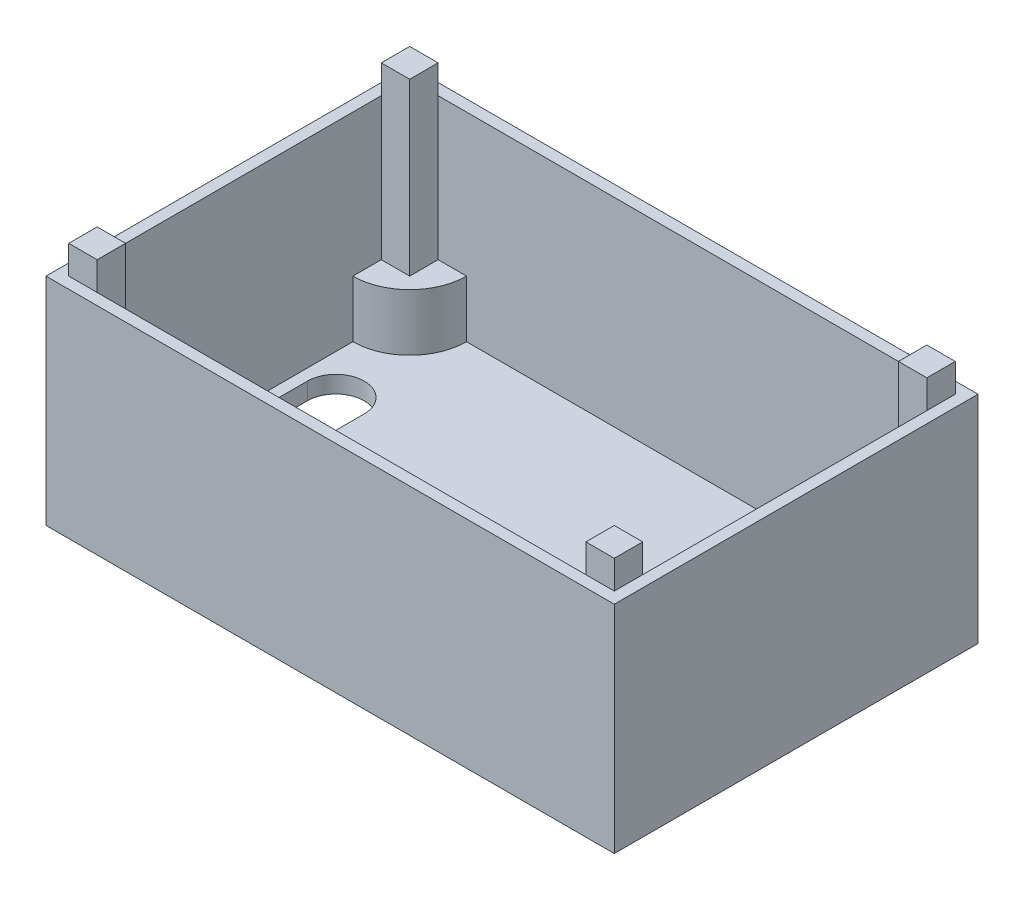
from build123d import *

# Parameters (mm, degrees)
SKETCH1_W                = 100
SKETCH1_H                = 64
BOSS_EXTRUDE1_DEPTH      = 3
SKETCH2_W                = 100
SKETCH2_H                = 64
SKETCH2_W_2              = 96
SKETCH2_H_2              = 60
BOSS_EXTRUDE2_DEPTH      = 35
BOSS_EXTRUDE9_DEPTH      = 5
BOSS_EXTRUDE9_DEPTH_BACK = 37
SKETCH12_W               = 5
SKETCH12_H               = 5
CUT_EXTRUDE6_DEPTH       = 72.582120673
BOSS_EXTRUDE11_DEPTH     = 10
SKETCH19_W               = 5
SKETCH19_H               = 5
CUT_EXTRUDE7_DEPTH       = 7
FILLET2_R                = 10


with BuildPart() as part:
    # Sketch1 → Boss-Extrude1 (new body)
    with BuildSketch(Plane(origin=(0, 0, 0), x_dir=(1, 0, 0), z_dir=(0, 1, 0))):
        Rectangle(SKETCH1_W, SKETCH1_H)
    extrude(amount=BOSS_EXTRUDE1_DEPTH)

    # Sketch2 → Boss-Extrude2 (add)
    with BuildSketch(Plane(origin=(0, 3, 0), x_dir=(1, 0, 0), z_dir=(0, 1, 0))):
        Rectangle(SKETCH2_W, SKETCH2_H)
        Rectangle(SKETCH2_W_2, SKETCH2_H_2, mode=Mode.SUBTRACT)
    extrude(amount=BOSS_EXTRUDE2_DEPTH)

    # Sketch12 → Boss-Extrude9 (add, two sides: drawn at the far end of the back side and taken through both)
    with BuildSketch(Plane(origin=(0, 38, 0), x_dir=(1, 0, 0), z_dir=(0, 1, 0)).offset(-BOSS_EXTRUDE9_DEPTH_BACK)):
        with Locations((-45.5, 27.5)):
            Rectangle(SKETCH12_W, SKETCH12_H)
        with Locations((45.5, 27.5)):
            Rectangle(SKETCH12_W, SKETCH12_H)
        with Locations((45.5, -27.5)):
            Rectangle(SKETCH12_W, SKETCH12_H)
        with Locations((-45.5, -27.5)):
            Rectangle(SKETCH12_W, SKETCH12_H)
    extrude(amount=BOSS_EXTRUDE9_DEPTH + BOSS_EXTRUDE9_DEPTH_BACK)

    # Sketch14 → Cut-Extrude6 (cut, through all)
    with BuildSketch(Plane(origin=(0, 3, 0), x_dir=(1, 0, 0), z_dir=(0, 1, 0))):
        with BuildLine():
            Line((-46, -10), (-46, 10))
            ThreePointArc((-46, 10), (-41, 15), (-36, 10))
            Line((-36, 10), (-36, -10))
            ThreePointArc((-36, -10), (-41, -15), (-46, -10))
        make_face()
    extrude(amount=-CUT_EXTRUDE6_DEPTH, mode=Mode.SUBTRACT)

    # Sketch17 → Boss-Extrude11 (add)
    with BuildSketch(Plane(origin=(0, 3, 0), x_dir=(1, 0, 0), z_dir=(0, 1, 0))):
        Polygon((-38, 30), (-43, 30), (-43, 25), (-48, 25), (-48, 20), (-38, 20), align=None)
        Polygon((43, 30), (38, 30), (38, 20), (48, 20), (48, 25), (43, 25), align=None)
        Polygon((48, -25), (48, -20), (38, -20), (38, -30), (43, -30), (43, -25), align=None)
        Polygon((-38, -20), (-48, -20), (-48, -25), (-43, -25), (-43, -30), (-38, -30), align=None)
    extrude(amount=BOSS_EXTRUDE11_DEPTH)

    # Sketch19 → Cut-Extrude7 (cut)
    with BuildSketch(Plane.XZ):
        with Locations((-45.5, 27.5)):
            Rectangle(SKETCH19_W, SKETCH19_H)
        with Locations((45.5, 27.5)):
            Rectangle(SKETCH19_W, SKETCH19_H)
        with Locations((45.5, -27.5)):
            Rectangle(SKETCH19_W, SKETCH19_H)
        with Locations((-45.5, -27.5)):
            Rectangle(SKETCH19_W, SKETCH19_H)
    extrude(amount=-CUT_EXTRUDE7_DEPTH, mode=Mode.SUBTRACT)

    # Fillet2
    fillet2_edges = [part.edges().sort_by_distance(p)[0] for p in [
        (-38, 8, 20),
        (38, 8, -20),
        (38, 8, 20),
        (-38, 8, -20),
    ]]
    fillet(fillet2_edges, radius=FILLET2_R - 0.0001)  # a hair under: the kernel refuses the full size


solid = part.part
